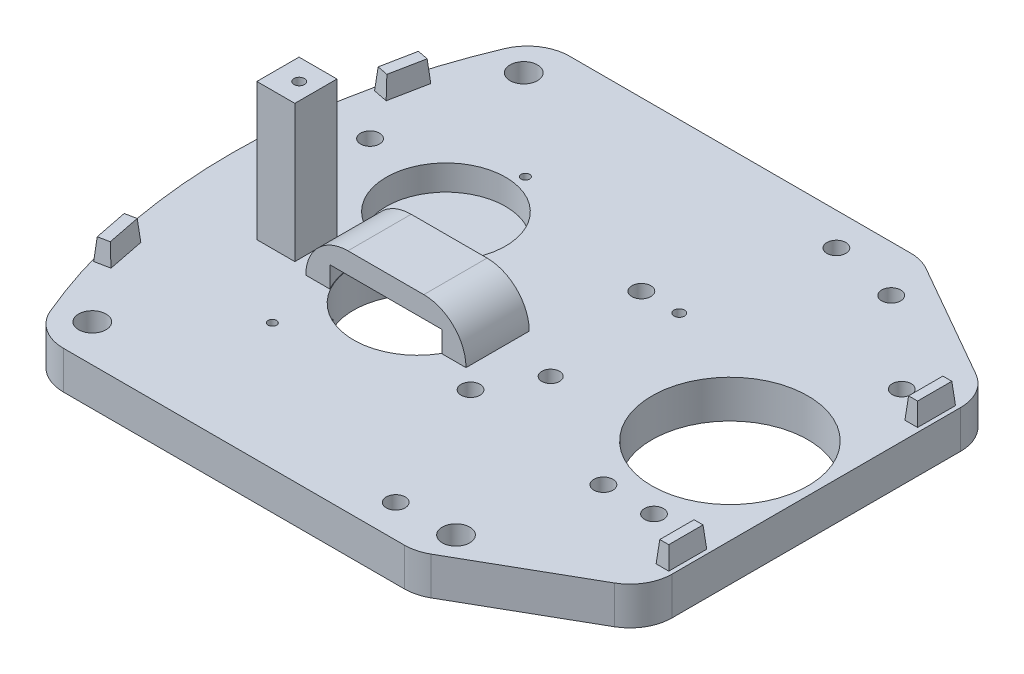
from build123d import *

# Parameters (mm, degrees)
SKETCH1_W                         = 125
SKETCH1_H                         = 120
TOP_BASE_DEPTH                    = 9
SKETCH5_R                         = 14.15
DRIVE_GEAR_HOLE_DEPTH             = 6
SKETCH28_R                        = 15.15
TWO_STAGE_GEAR_HOLE_DEPTH         = 174.51080658
SKETCH8_R                         = 18.5
XL320_FINGER_KNUCKLE_MOUNT_DEPTH  = 174.51080658
SKETCH26_R                        = 1
STRING_HOLES_DEPTH                = 174.51080658
XL320_MOUNT_HOLES_R               = 2.25
XL320_MOUNT_HOLES_M4_DEPTH        = 174.51080658
AX12_MOUNT_HOLES_R                = 2.25
AX12_MOUNT_HOLES_M4_DEPTH         = 174.51080658
NUTS_M4_DEPTH                     = 5
SKETCH34_R                        = 15
HOLES_FOR_M4_IN_FINGER_GEAR_DEPTH = 2
SKETCH31_W                        = 38
SKETCH31_H                        = 15
BOSS_EXTRUDE1_DEPTH               = 10
SKETCH32_R                        = 15.25
CUT_EXTRUDE5_DEPTH                = 5
SKETCH33_R                        = 1
CUT_EXTRUDE6_DEPTH                = 2.5
FILLET2_R                         = 10
CUT_EXTRUDE8_DEPTH                = 174.565549577
FILLET4_R                         = 10
SKETCH37_R                        = 3.25
CONNECT_HOLES_M6_DEPTH            = 10
SKETCH41_R                        = 2.1
CONNECT_TO_HOUSE_M4_DEPTH         = 174.565549577
SKETCH42_W                        = 3
SKETCH42_H                        = 9
HOUSING_FITS_DEPTH                = 5
HOUSING_FITS_DRAFT                = 5
HOUSING_FITS_PROFILE_2_DEPTH      = 5
HOUSING_FITS_PROFILE_2_DRAFT      = 5
HOUSING_FITS_PROFILE_3_DEPTH      = 5
HOUSING_FITS_PROFILE_3_DRAFT      = 5
HOUSING_FITS_PROFILE_4_DEPTH      = 5
HOUSING_FITS_PROFILE_4_DRAFT      = 5
SKETCH43_R                        = 1
M2_SHAFT_HOLE_DEPTH               = 2
SKETCH54_R                        = 1.5
HOLLOW_SHAFT_HOLE_DEPTH           = 5
SKETCH46_R                        = 1.25
CUT_EXTRUDE11_DEPTH               = 174.565549577
SKETCH47_R                        = 1.75
CUT_EXTRUDE12_DEPTH               = 5
SKETCH48_R                        = 2.5
CUT_EXTRUDE13_DEPTH               = 0.75
SKETCH49_R                        = 1.25
BOSS_EXTRUDE2_DEPTH               = 32.5
SKETCH51_R                        = 1.25
CUT_EXTRUDE14_DEPTH               = 177.298752123
SKETCH52_R                        = 1.75
CUT_EXTRUDE15_DEPTH               = 5
SKETCH53_R                        = 2.5
CUT_EXTRUDE16_DEPTH               = 0.75
FILLET5_R                         = 0.5


with BuildPart() as part:
    # Sketch1 → Top_Base (new body)
    with BuildSketch(Plane(origin=(0, 0, 0), x_dir=(1, 0, 0), z_dir=(0, 1, 0))):
        with BuildLine():
            ThreePointArc((0, 120), (-13.654246239, 60), (0, 0))
            Line((0, 0), (0, 120))
        make_face()
        with Locations((62.5, 60)):
            Rectangle(SKETCH1_W, SKETCH1_H)
    extrude(amount=TOP_BASE_DEPTH)

    # Sketch5 → Drive_Gear_Hole (cut)
    with BuildSketch(Plane(origin=(0, 9, 0), x_dir=(1, 0, 0), z_dir=(0, 1, 0))):
        with Locations(Location((23.75, 73.41386581, 0), (0, 0, 270))):
            Circle(SKETCH5_R)
    extrude(amount=-DRIVE_GEAR_HOLE_DEPTH, mode=Mode.SUBTRACT)

    # Sketch28 → Two_Stage_Gear_Hole (cut, through all)
    with BuildSketch(Plane(origin=(0, 9, 0), x_dir=(1, 0, 0), z_dir=(0, 1, 0))):
        with Locations(Location((39.169567191, 51.25, 0), (0, 0, 270))):
            Circle(SKETCH28_R)
    extrude(amount=-TWO_STAGE_GEAR_HOLE_DEPTH, mode=Mode.SUBTRACT)

    # Sketch8 → XL320_Finger_Knuckle_Mount (cut, through all)
    with BuildSketch(Plane(origin=(0, 9, 0), x_dir=(1, 0, 0), z_dir=(0, 1, 0))):
        with Locations(Location((104.5, 60, 0), (0, 0, 270))):
            Circle(SKETCH8_R)
    extrude(amount=-XL320_FINGER_KNUCKLE_MOUNT_DEPTH, mode=Mode.SUBTRACT)

    # Sketch26 → String_Holes (cut, through all)
    with BuildSketch(Plane.XZ.offset(-9)):
        with Locations(Location((26, -30, 0), (0, 0, 270))):
            Circle(SKETCH26_R)
        with Locations(Location((26, -90, 0), (0, 0, 90))):
            Circle(SKETCH26_R)
    extrude(amount=STRING_HOLES_DEPTH, mode=Mode.SUBTRACT)

    # XL320_Mount_Holes → XL320_Mount_Holes_(M4) (cut, through all)
    with BuildSketch(Plane(origin=(0, 9, 0), x_dir=(1, 0, 0), z_dir=(0, 1, 0))):
        with Locations(Location((110.5, 36, 0), (0, 0, 270))):
            Circle(XL320_MOUNT_HOLES_R)
        with Locations(Location((98.5, 36, 0), (0, 0, 270))):
            Circle(XL320_MOUNT_HOLES_R)
        with Locations(Location((-0.25, 79.41386581, 0), (0, 0, 270))):
            Circle(XL320_MOUNT_HOLES_R)
        with Locations(Location((-0.25, 67.41386581, 0), (0, 0, 270))):
            Circle(XL320_MOUNT_HOLES_R)
    extrude(amount=-XL320_MOUNT_HOLES_M4_DEPTH, mode=Mode.SUBTRACT)

    # AX12_Mount_Holes → AX12_Mount_Holes_(M4) (cut, through all)
    with BuildSketch(Plane(origin=(0, 9, 0), x_dir=(1, 0, 0), z_dir=(0, 1, 0))):
        with Locations(Location((77.5, 112.25, 0), (0, 0, 270))):
            Circle(AX12_MOUNT_HOLES_R)
        with Locations(Location((63.25, 80.25, 0), (0, 0, 270))):
            Circle(AX12_MOUNT_HOLES_R)
        with Locations(Location((114.25, 91, 0), (0, 0, 270))):
            Circle(AX12_MOUNT_HOLES_R)
        with Locations(Location((93.75, 109, 0), (0, 0, 270))):
            Circle(AX12_MOUNT_HOLES_R)
        with Locations(Location((63.25, 39.75, 0), (0, 0, 270))):
            Circle(AX12_MOUNT_HOLES_R)
        with Locations(Location((77.5, 7.75, 0), (0, 0, 270))):
            Circle(AX12_MOUNT_HOLES_R)
    extrude(amount=-AX12_MOUNT_HOLES_M4_DEPTH, mode=Mode.SUBTRACT)

    # Sketch27 → Nuts_(M4) (cut)
    with BuildSketch(Plane.XZ):
        Polygon((110.5, -31.669872981), (106.75, -33.834936491), (106.75, -38.165063509), (110.5, -40.330127019), (114.25, -38.165063509), (114.25, -33.834936491), align=None)
        Polygon((98.5, -31.669872981), (94.75, -33.834936491), (94.75, -38.165063509), (98.5, -40.330127019), (102.25, -38.165063509), (102.25, -33.834936491), align=None)
        Polygon((3.5, -65.2488023), (-0.25, -63.083738791), (-4, -65.2488023), (-4, -69.578929319), (-0.25, -71.743992829), (3.5, -69.578929319), align=None)
        Polygon((-4, -77.2488023), (-4, -81.578929319), (-0.25, -83.743992829), (3.5, -81.578929319), (3.5, -77.2488023), (-0.25, -75.083738791), align=None)
    extrude(amount=-NUTS_M4_DEPTH, mode=Mode.SUBTRACT)

    # Sketch34 → Holes_For_M4_In_Finger_Gear (cut)
    with BuildSketch(Plane.XZ):
        with Locations((26, -30)):
            Circle(SKETCH34_R)
        with Locations(Location((26, -90, 0), (0, 0, 270))):
            Circle(SKETCH34_R)
    extrude(amount=-HOLES_FOR_M4_IN_FINGER_GEAR_DEPTH, mode=Mode.SUBTRACT)

    # Sketch31 → Boss-Extrude1 (add)
    with BuildSketch(Plane(origin=(0, 9, 0), x_dir=(1, 0, 0), z_dir=(0, 1, 0))):
        with Locations((39.169567191, 51.25)):
            Rectangle(SKETCH31_W, SKETCH31_H)
    extrude(amount=BOSS_EXTRUDE1_DEPTH)

    # Sketch32 → Cut-Extrude5 (cut)
    with BuildSketch(Plane.XZ.offset(-9)):
        with Locations((39.169567191, -51.25)):
            Circle(SKETCH32_R)
    extrude(amount=-CUT_EXTRUDE5_DEPTH, mode=Mode.SUBTRACT)

    # Sketch33 → Cut-Extrude6 (cut)
    with BuildSketch(Plane.XZ.offset(-14)):
        with Locations(Location((39.169567191, -51.25, 0), (0, 0, 270))):
            Circle(SKETCH33_R)
    extrude(amount=-CUT_EXTRUDE6_DEPTH, mode=Mode.SUBTRACT)

    # Fillet2
    fillet2_edges = [part.edges().sort_by_distance(p)[0] for p in [
        (58.169567191, 19, -51.25),
        (20.169567191, 19, -51.25),
    ]]
    fillet(fillet2_edges, radius=FILLET2_R - 0.0001)  # a hair under: the kernel refuses the full size

    # Sketch36 → Cut-Extrude8 (cut, through all)
    with BuildSketch(Plane(origin=(0, 9, 0), x_dir=(1, 0, 0), z_dir=(0, 1, 0))):
        Polygon((90, 120), (125, 100), (125, 120), align=None)
        Polygon((125, 0), (90, 0), (125, 20), align=None)
    extrude(amount=-CUT_EXTRUDE8_DEPTH, mode=Mode.SUBTRACT)

    # Fillet4
    fillet4_edges = [part.edges().sort_by_distance(p)[0] for p in [
        (90, 4.5, -120),
        (125, 4.5, -100),
        (125, 4.5, -20),
        (90, 4.5, 0),
        (0, 4.5, -120),
        (0, 4.5, 0),
    ]]
    fillet(fillet4_edges, radius=FILLET4_R)

    # Sketch37 → Connect_Holes_(M6) (cut)
    with BuildSketch(Plane(origin=(0, 9, 0), x_dir=(1, 0, 0), z_dir=(0, 1, 0))):
        with Locations(Location((4.459226107, 111.152938298, 0), (0, 0, 270))):
            Circle(SKETCH37_R)
        with Locations(Location((4.459226107, 8.847061702, 0), (0, 0, 270))):
            Circle(SKETCH37_R)
        with Locations(Location((91.344355629, 8.205555711, 0), (0, 0, 270))):
            Circle(SKETCH37_R)
    extrude(amount=-CONNECT_HOLES_M6_DEPTH, mode=Mode.SUBTRACT)

    # Sketch41 → Connect_To_House_(M4) (cut, through all)
    with BuildSketch(Plane(origin=(0, 9, 0), x_dir=(1, 0, 0), z_dir=(0, 1, 0))):
        with Locations(Location((70, 52, 0), (0, 0, 270))):
            Circle(SKETCH41_R)
    extrude(amount=-CONNECT_TO_HOUSE_M4_DEPTH, mode=Mode.SUBTRACT)


with BuildPart() as housing_fits_tool:
    # Sketch42 → Housing_Fits (with draft: the straight prism first)
    with BuildSketch(Plane(origin=(0, 9, 0), x_dir=(1, 0, 0), z_dir=(0, 1, 0))):
        with Locations((122.5, 30.5)):
            Rectangle(SKETCH42_W, SKETCH42_H)
    extrude(amount=HOUSING_FITS_DEPTH)
    # Housing_Fits: the draft: its side faces are tilted about the plane it starts from
    housing_fits_sides = [housing_fits_tool.faces().sort_by_distance(p)[0] for p in [
        (124, 11.5, -30.5),
        (122.5, 11.5, -35),
        (121, 11.5, -30.5),
        (122.5, 11.5, -26),
    ]]
    draft(housing_fits_sides, Plane(origin=(0, 9, 0), x_dir=(1, 0, 0), z_dir=(0, 1, 0)), HOUSING_FITS_DRAFT)


with BuildPart() as part_1:
    add(part.part)

    # Housing_Fits: add housing_fits_tool
    add(housing_fits_tool.part)


with BuildPart() as housing_fits_profile_2_tool:
    # Sketch42 → Housing_Fits profile 2 (with draft: the straight prism first)
    with BuildSketch(Plane(origin=(0, 9, 0), x_dir=(1, 0, 0), z_dir=(0, 1, 0))):
        Polygon((-9.533377338, 30.232888291), (-7.782151246, 21.404909633), (-4.349048435, 22.085942002), (-6.100274527, 30.91392066), align=None)
    extrude(amount=HOUSING_FITS_PROFILE_2_DEPTH)
    # Housing_Fits profile 2: the draft: its side faces are tilted about the plane it starts from
    housing_fits_profile_2_sides = [housing_fits_profile_2_tool.faces().sort_by_distance(p)[0] for p in [
        (-8.657764292, 11.5, -25.818898962),
        (-6.065599841, 11.5, -21.745425818),
        (-5.224661481, 11.5, -26.499931331),
        (-7.816825933, 11.5, -30.573404475),
    ]]
    draft(housing_fits_profile_2_sides, Plane(origin=(0, 9, 0), x_dir=(1, 0, 0), z_dir=(0, 1, 0)), HOUSING_FITS_PROFILE_2_DRAFT)


with BuildPart() as part_2:
    add(part_1.part)

    # Housing_Fits profile 2: add housing_fits_profile_2_tool
    add(housing_fits_profile_2_tool.part)


with BuildPart() as housing_fits_profile_3_tool:
    # Sketch42 → Housing_Fits profile 3 (with draft: the straight prism first)
    with BuildSketch(Plane(origin=(0, 9, 0), x_dir=(1, 0, 0), z_dir=(0, 1, 0))):
        Polygon((-4.349048435, 97.914057998), (-7.782151246, 98.595090367), (-9.533377338, 89.767111709), (-6.100274527, 89.08607934), align=None)
    extrude(amount=HOUSING_FITS_PROFILE_3_DEPTH)
    # Housing_Fits profile 3: the draft: its side faces are tilted about the plane it starts from
    housing_fits_profile_3_sides = [housing_fits_profile_3_tool.faces().sort_by_distance(p)[0] for p in [
        (-6.065599841, 11.5, -98.254574182),
        (-8.657764292, 11.5, -94.181101038),
        (-7.816825933, 11.5, -89.426595525),
        (-5.224661481, 11.5, -93.500068669),
    ]]
    draft(housing_fits_profile_3_sides, Plane(origin=(0, 9, 0), x_dir=(1, 0, 0), z_dir=(0, 1, 0)), HOUSING_FITS_PROFILE_3_DRAFT)


with BuildPart() as part_3:
    add(part_2.part)

    # Housing_Fits profile 3: add housing_fits_profile_3_tool
    add(housing_fits_profile_3_tool.part)


with BuildPart() as housing_fits_profile_4_tool:
    # Sketch42 → Housing_Fits profile 4 (with draft: the straight prism first)
    with BuildSketch(Plane(origin=(0, 9, 0), x_dir=(1, 0, 0), z_dir=(0, 1, 0))):
        with Locations((122.5, 89.5)):
            Rectangle(SKETCH42_W, SKETCH42_H)
    extrude(amount=HOUSING_FITS_PROFILE_4_DEPTH)
    # Housing_Fits profile 4: the draft: its side faces are tilted about the plane it starts from
    housing_fits_profile_4_sides = [housing_fits_profile_4_tool.faces().sort_by_distance(p)[0] for p in [
        (122.5, 11.5, -94),
        (121, 11.5, -89.5),
        (122.5, 11.5, -85),
        (124, 11.5, -89.5),
    ]]
    draft(housing_fits_profile_4_sides, Plane(origin=(0, 9, 0), x_dir=(1, 0, 0), z_dir=(0, 1, 0)), HOUSING_FITS_PROFILE_4_DRAFT)


with BuildPart() as part_4:
    add(part_3.part)

    # Housing_Fits profile 4: add housing_fits_profile_4_tool
    add(housing_fits_profile_4_tool.part)

    # Sketch43 → M2_Shaft_Hole (cut)
    with BuildSketch(Plane.XZ):
        with Locations(Location((39.169567191, -68.75, 0), (0, 0, 270))):
            Circle(SKETCH43_R)
    extrude(amount=-M2_SHAFT_HOLE_DEPTH, mode=Mode.SUBTRACT)

    # Sketch54 → Hollow_Shaft_Hole (cut)
    with BuildSketch(Plane.XZ.offset(-2)):
        with Locations(Location((26, -30, 0), (0, 0, 270))):
            Circle(SKETCH54_R)
        with Locations(Location((26, -90, 0), (0, 0, 270))):
            Circle(SKETCH54_R)
    extrude(amount=-HOLLOW_SHAFT_HOLE_DEPTH, mode=Mode.SUBTRACT)

    # Sketch46 → Cut-Extrude11 (cut, through all)
    with BuildSketch(Plane(origin=(0, 9, 0), x_dir=(1, 0, 0), z_dir=(0, 1, 0))):
        with Locations(Location((72.25, 80.25, 0), (0, 0, 270))):
            Circle(SKETCH46_R)
    extrude(amount=-CUT_EXTRUDE11_DEPTH, mode=Mode.SUBTRACT)

    # Sketch47 → Cut-Extrude12 (cut)
    with BuildSketch(Plane.XZ):
        with Locations(Location((72.25, -80.25, 0), (0, 0, 270))):
            Circle(SKETCH47_R)
    extrude(amount=-CUT_EXTRUDE12_DEPTH, mode=Mode.SUBTRACT)

    # Sketch48 → Cut-Extrude13 (cut)
    with BuildSketch(Plane.XZ):
        with Locations(Location((72.25, -80.25, 0), (0, 0, 270))):
            Circle(SKETCH48_R)
    extrude(amount=-CUT_EXTRUDE13_DEPTH, mode=Mode.SUBTRACT)

    # Sketch49 → Boss-Extrude2 (add)
    with BuildSketch(Plane(origin=(0, 9, 0), x_dir=(1, 0, 0), z_dir=(0, 1, 0))):
        Polygon((16.093653761, 45.2322), (12.132053761, 45.2322), (7.093653761, 45.2322), (7.093653761, 55.2322), (12.132053761, 55.2322), (16.093653761, 55.2322), align=None)
        with Locations(Location((12.132053761, 50.2322, 0), (0, 0, 270))):
            Circle(SKETCH49_R, mode=Mode.SUBTRACT)
    extrude(amount=BOSS_EXTRUDE2_DEPTH)

    # Sketch51 → Cut-Extrude14 (cut, through all)
    with BuildSketch(Plane(origin=(0, 9, 0), x_dir=(1, 0, 0), z_dir=(0, 1, 0))):
        with Locations(Location((12.132053761, 50.2322, 0), (0, 0, 270))):
            Circle(SKETCH51_R)
    extrude(amount=-CUT_EXTRUDE14_DEPTH, mode=Mode.SUBTRACT)

    # Sketch52 → Cut-Extrude15 (cut)
    with BuildSketch(Plane.XZ):
        with Locations(Location((12.132053761, -50.2322, 0), (0, 0, 270))):
            Circle(SKETCH52_R)
    extrude(amount=-CUT_EXTRUDE15_DEPTH, mode=Mode.SUBTRACT)

    # Sketch53 → Cut-Extrude16 (cut)
    with BuildSketch(Plane.XZ):
        with Locations(Location((12.132053761, -50.2322, 0), (0, 0, 270))):
            Circle(SKETCH53_R)
    extrude(amount=-CUT_EXTRUDE16_DEPTH, mode=Mode.SUBTRACT)

    # Fillet5
    fillet5_edges = [part_4.edges().sort_by_distance(p)[0] for p in [
        (72.25, 0, -77.75),
        (12.132053761, 0, -47.7322),
    ]]
    fillet(fillet5_edges, radius=FILLET5_R)


solid = part_4.part
